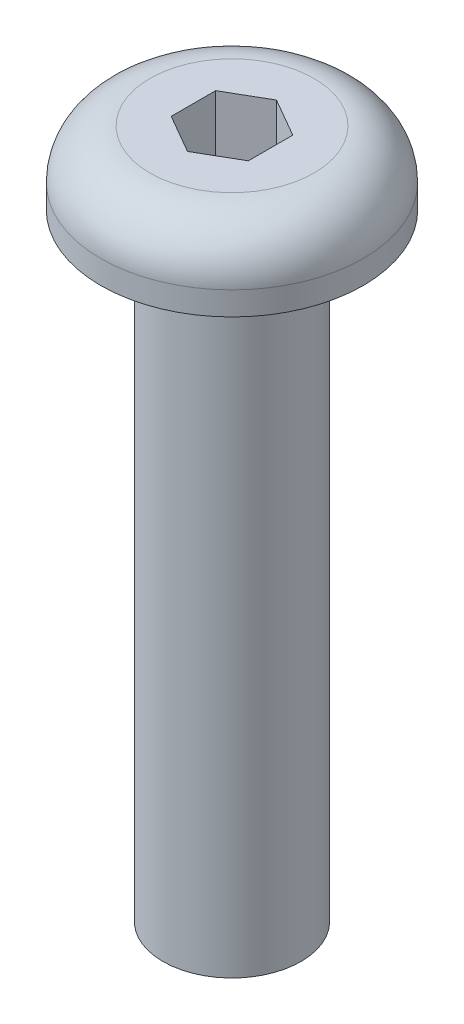
from build123d import *

# Parameters (mm, degrees)
SKETCH1_R           = 1.4224
BOSS_EXTRUDE1_DEPTH = 12.7
SKETCH2_R           = 2.7051
BOSS_EXTRUDE2_DEPTH = 1.4986
FILLET1_R           = 1.016
CUT_EXTRUDE1_DEPTH  = 2.38125


with BuildPart() as part:
    # Sketch1 → Boss-Extrude1 (new body)
    with BuildSketch(Plane(origin=(0, 0, 0), x_dir=(1, 0, 0), z_dir=(0, 1, 0))):
        Circle(SKETCH1_R)
    extrude(amount=BOSS_EXTRUDE1_DEPTH)

    # Sketch2 → Boss-Extrude2 (add)
    with BuildSketch(Plane(origin=(0, 12.7, 0), x_dir=(1, 0, 0), z_dir=(0, 1, 0))):
        Circle(SKETCH2_R)
    extrude(amount=BOSS_EXTRUDE2_DEPTH)

    # Fillet1
    fillet1_edges = [part.edges().sort_by_distance(p)[0] for p in [
        (-2.7051, 14.1986, 0),
    ]]
    fillet(fillet1_edges, radius=FILLET1_R)

    # Sketch3 → Cut-Extrude1 (cut)
    with BuildSketch(Plane(origin=(0, 14.1986, 0), x_dir=(1, 0, 0), z_dir=(0, 1, 0))):
        Polygon((0, 0.916543552), (-0.79375, 0.458271776), (-0.79375, -0.458271776), (0, -0.916543552), (0.79375, -0.458271776), (0.79375, 0.458271776), align=None)
    extrude(amount=-CUT_EXTRUDE1_DEPTH, mode=Mode.SUBTRACT)


solid = part.part
